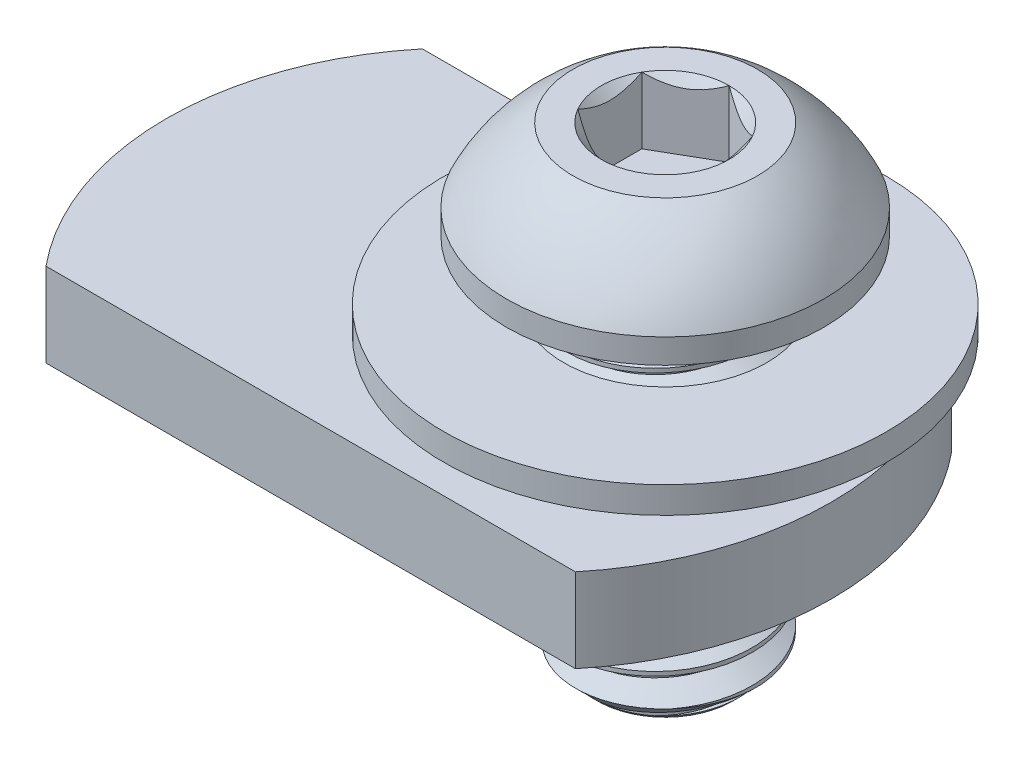
from build123d import *

# Parameters (mm, degrees)
SKETCH1_R           = 3.96875
BOSS_EXTRUDE1_DEPTH = 15.875
CUT_SWEEP1_PITCH    = 1.411111111
SKETCH4_OUTSIDE_W   = 16.648
SKETCH4_OUTSIDE_H   = 16.648
SKETCH4_OUTSIDE_R   = 2.899449189
CUT_EXTRUDE1_DEPTH  = 1.411111111
CUT_EXTRUDE1_DRAFT  = -45
CUT_EXTRUDE2_DEPTH  = 2.8575
BOSS_EXTRUDE2_START = -6.35
SKETCH8_R           = 3.96875
BOSS_EXTRUDE2_DEPTH = 3.6068
SKETCH9_R           = 4.5593
SKETCH9_R_2         = 3.96875
BOSS_EXTRUDE3_DEPTH = 2.032
SKETCH10_W          = 5.1435
SKETCH10_H          = 1.143


with BuildPart() as part:
    # Sketch1 → Boss-Extrude1 (new body)
    with BuildSketch(Plane(origin=(0, 0, 0), x_dir=(1, 0, 0), z_dir=(0, 1, 0))):
        with Locations(Location((0, 0, 0), (0, 0, 270))):
            Circle(SKETCH1_R)
    extrude(amount=-BOSS_EXTRUDE1_DEPTH)

    # Cut-Sweep1: the profile of Sketch3 screwed along a right-hand helix of 12.25 turns, 8 arcs to a turn; built about Z, then put on its axis
    cut_sweep1_z = Axis((0, 0, 0), (0, 0, 1))
    cut_sweep1_corners = [(3.052206448, 0, -0.529166667), (4.045128629, 0, 0.044097222), (4.045128629, 0, -1.278819444), (3.052206448, 0, -0.705555556)]
    with BuildLine(mode=Mode.PRIVATE) as cut_sweep1_profile:
        Line(cut_sweep1_corners[0], cut_sweep1_corners[1])
        Line(cut_sweep1_corners[1], cut_sweep1_corners[2])
        Line(cut_sweep1_corners[2], cut_sweep1_corners[3])
        Line(cut_sweep1_corners[3], cut_sweep1_corners[0])
    cut_sweep1_cap = Face(cut_sweep1_profile.wire())
    cut_sweep1_turn_angles = [0, 22.5, 45, 67.5, 90, 112.5, 135, 157.5, 180, 202.5, 225, 247.5, 270, 292.5, 315, 337.5, 360]
    cut_sweep1_turn_weights = [1, 0.9238795325112867, 1, 0.9238795325112867, 1, 0.9238795325112867, 1, 0.9238795325112867, 1, 0.9238795325112867, 1, 0.9238795325112867, 1, 0.9238795325112867, 1, 0.9238795325112867, 1]
    cut_sweep1_turn_rails = [Edge.make_bspline([Vector(p[0], p[1], 0).rotate(cut_sweep1_z, cut_sweep1_turn_angles[k]) / cut_sweep1_turn_weights[k] + Vector(0, 0, p[2] + CUT_SWEEP1_PITCH * cut_sweep1_turn_angles[k] / 360) for k in range(17)], [0, 0, 0, 1, 1, 2, 2, 3, 3, 4, 4, 5, 5, 6, 6, 7, 7, 8, 8, 8], 2, cut_sweep1_turn_weights) for p in cut_sweep1_corners]
    cut_sweep1_turn_sides = [Face.make_surface_from_curves(cut_sweep1_turn_rails[p[0]], cut_sweep1_turn_rails[p[1]]) for p in [(0, 1), (1, 2), (2, 3), (3, 0)]]
    cut_sweep1_last_angles = [4320, 4342.5, 4365, 4387.5, 4410]
    cut_sweep1_last_weights = [1, 0.9238795325112867, 1, 0.9238795325112139, 1]
    cut_sweep1_last_rails = [Edge.make_bspline([Vector(p[0], p[1], 0).rotate(cut_sweep1_z, cut_sweep1_last_angles[k]) / cut_sweep1_last_weights[k] + Vector(0, 0, p[2] + CUT_SWEEP1_PITCH * cut_sweep1_last_angles[k] / 360) for k in range(5)], [0, 0, 0, 1, 1, 2, 2, 2], 2, cut_sweep1_last_weights) for p in cut_sweep1_corners]
    cut_sweep1_last_sides = [Face.make_surface_from_curves(cut_sweep1_last_rails[p[0]], cut_sweep1_last_rails[p[1]]) for p in [(0, 1), (1, 2), (2, 3), (3, 0)]]
    cut_sweep1 = Plane(origin=(0, -15.875, 0), x_dir=(0, 0, -1), z_dir=(0, 1, 0)) * Solid(Shell([*[p.moved(Location((0, 0, CUT_SWEEP1_PITCH * i))) for i in range(12) for p in cut_sweep1_turn_sides], *cut_sweep1_last_sides, cut_sweep1_cap, cut_sweep1_cap.rotate(cut_sweep1_z, 4410).moved(Location((0, 0, CUT_SWEEP1_PITCH * 4410 / 360)))]))
    add(cut_sweep1, mode=Mode.SUBTRACT)


with BuildPart() as cut_extrude1_tool:
    # Sketch4 outside → Cut-Extrude1 (with draft: the straight prism first)
    with BuildSketch(Plane.XZ.offset(15.875)):
        Rectangle(SKETCH4_OUTSIDE_W, SKETCH4_OUTSIDE_H)
        Circle(SKETCH4_OUTSIDE_R, mode=Mode.SUBTRACT)
    extrude(amount=-CUT_EXTRUDE1_DEPTH)
    # Cut-Extrude1: the draft: its side faces are tilted about the plane it starts from
    cut_extrude1_sides = [cut_extrude1_tool.faces().sort_by_distance(p)[0] for p in [
        (0, -15.169444444, -8.324),
        (8.324, -15.169444444, 0),
        (0, -15.169444444, 8.324),
        (-8.324, -15.169444444, 0),
        (-2.899449189, -15.169444444, 0),
    ]]
    draft(cut_extrude1_sides, Plane.XZ.offset(15.875), CUT_EXTRUDE1_DRAFT)


with BuildPart() as part_1:
    add(part.part)

    # Cut-Extrude1: cut by cut_extrude1_tool
    add(cut_extrude1_tool.part, mode=Mode.SUBTRACT)

    # Sketch5 → Revolve1 (revolve)
    with BuildSketch(Plane.XY, mode=Mode.PRIVATE) as revolve1_sk:
        with BuildLine():
            Line((0, 0), (0, 4.2164))
            Line((0, 4.2164), (-3.96875, 4.2164))
            ThreePointArc((-3.96875, 4.2164), (-5.621278994, 2.839873179), (-6.8199, 1.0541))
            Line((-6.8199, 1.0541), (-6.8199, 0))
            Line((-6.8199, 0), (0, 0))
        make_face()
    revolve(revolve1_sk.sketch.rotate(Axis((0, 0, 0), (0, 1, 0)), 270), axis=Axis((0, 0, 0), (0, 1, 0)))

    # Sketch6 → Cut-Extrude2 (cut)
    with BuildSketch(Plane(origin=(0, 4.2164, 0), x_dir=(1, 0, 0), z_dir=(0, 1, 0))):
        Polygon((0, 2.749630657), (-2.38125, 1.374815329), (-2.38125, -1.374815329), (0, -2.749630657), (2.38125, -1.374815329), (2.38125, 1.374815329), align=None)
    extrude(amount=-CUT_EXTRUDE2_DEPTH, mode=Mode.SUBTRACT)

    # Cut-Extrude3 cone 1 section (through the dimple's axis) → Cut-Extrude3 (revolve, cut)
    with BuildSketch(Plane(origin=(0, 4.2164, 0), x_dir=(0, 0, 1), z_dir=(1, 0, 0))):
        Polygon((0, 0), (2.749630657, 0), (0, 2.749630657), align=None)
    revolve(axis=Axis((0, 4.2164, 0), (0, -1, 0)), mode=Mode.SUBTRACT)


with BuildPart() as body_2:
    # Sketch8 → Boss-Extrude2 (new body)
    with BuildSketch(Plane(origin=(0, 0, 0), x_dir=(1, 0, 0), z_dir=(0, 1, 0)).offset(BOSS_EXTRUDE2_START)):
        with BuildLine():
            Line((-18.527570275, 8.0899), (4.227370275, 8.0899))
            ThreePointArc((4.227370275, 8.0899), (7.1374, 0), (4.227370275, -8.0899))
            Line((4.227370275, -8.0899), (-18.527570275, -8.0899))
            ThreePointArc((-18.527570275, -8.0899), (-21.4376, 0), (-18.527570275, 8.0899))
        make_face()
        with Locations(Location((0, 0, 0), (0, 0, 270))):
            Circle(SKETCH8_R, mode=Mode.SUBTRACT)
    extrude(amount=-BOSS_EXTRUDE2_DEPTH)

    # Sketch9 → Boss-Extrude3 (add)
    with BuildSketch(Plane.XZ.offset(9.9568)):
        with Locations(Location((0, 0, 0), (0, 0, 90))):
            Circle(SKETCH9_R)
        with Locations(Location((0, 0, 0), (0, 0, 90))):
            Circle(SKETCH9_R_2, mode=Mode.SUBTRACT)
    extrude(amount=BOSS_EXTRUDE3_DEPTH)


with BuildPart() as body_3:
    # Sketch10 → Revolve2 (revolve)
    with BuildSketch(Plane.XY, mode=Mode.PRIVATE) as revolve2_sk:
        with Locations((-6.94055, -3.1115)):
            Rectangle(SKETCH10_W, SKETCH10_H)
    revolve(revolve2_sk.sketch.rotate(Axis((0, -15.875, 0), (0, 1, 0)), 270), axis=Axis((0, -15.875, 0), (0, 1, 0)))


solid = Compound([part_1.part, body_2.part, body_3.part])
